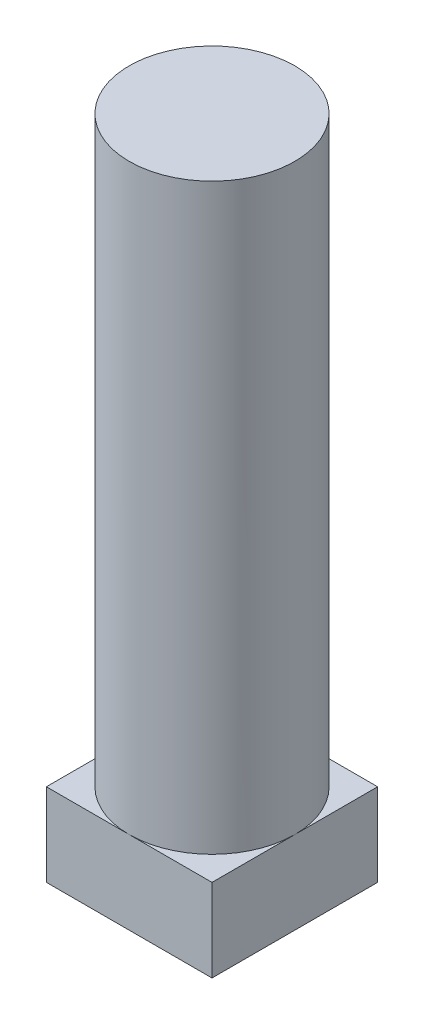
from build123d import *

# Parameters (mm, degrees)
SKETCH1_W           = 5
SKETCH1_H           = 5
BOSS_EXTRUDE1_DEPTH = 2.5
SKETCH2_R           = 2.5
BOSS_EXTRUDE2_DEPTH = 17.6


with BuildPart() as part:
    # Sketch1 → Boss-Extrude1 (new body)
    with BuildSketch(Plane(origin=(0, 0, 0), x_dir=(1, 0, 0), z_dir=(0, 1, 0))):
        Rectangle(SKETCH1_W, SKETCH1_H)
    extrude(amount=BOSS_EXTRUDE1_DEPTH)

    # Sketch2 → Boss-Extrude2 (add)
    with BuildSketch(Plane(origin=(0, 2.5, 0), x_dir=(1, 0, 0), z_dir=(0, 1, 0))):
        Circle(SKETCH2_R)
    extrude(amount=BOSS_EXTRUDE2_DEPTH)


solid = part.part
